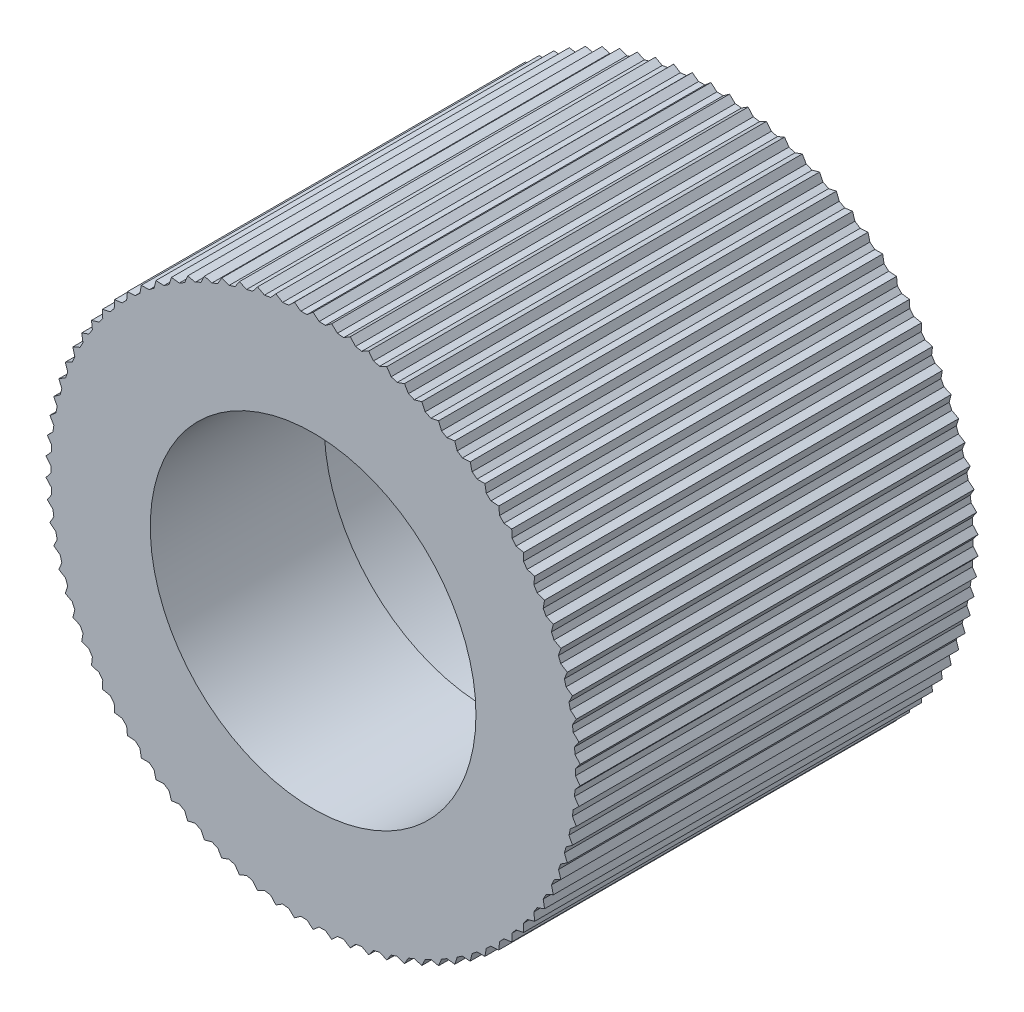
from build123d import *

# Parameters (mm, degrees)
CROQUIS1_R              = 5.275
CROQUIS1_R_2            = 3.275
SALIENTE_EXTRUIR1_DEPTH = 1.75
CROQUIS2_R              = 5.275
CROQUIS2_R_2            = 3.975
SALIENTE_EXTRUIR2_DEPTH = 4.5
SALIENTE_EXTRUIR3_START = 1.75
SALIENTE_EXTRUIR3_DEPTH = 8
MATRIZC1_COUNT          = 90


with BuildPart() as part:
    # Croquis1 → Saliente-Extruir1 (new, symmetric)
    with BuildSketch(Plane.XY):
        Circle(CROQUIS1_R)
        Circle(CROQUIS1_R_2, mode=Mode.SUBTRACT)
    extrude(amount=SALIENTE_EXTRUIR1_DEPTH, both=True)

    # Croquis2 → Saliente-Extruir2 (add)
    with BuildSketch(Plane(origin=(0, 0, -1.75), x_dir=(-1, 0, 0), z_dir=(0, 0, -1))):
        Circle(CROQUIS2_R)
        Circle(CROQUIS2_R_2, mode=Mode.SUBTRACT)
    extrude(amount=SALIENTE_EXTRUIR2_DEPTH)

    # Croquis6 → Saliente-Extruir3 (add)
    with BuildSketch(Plane.XY.offset(SALIENTE_EXTRUIR3_START)):
        with BuildLine():
            Line((0, 5.375), (0, 5.275))
            ThreePointArc((0, 5.275), (0.060416297, 5.274654005), (0.120824669, 5.273616065))
            Line((0.120824669, 5.273616065), (0, 5.375))
        make_face()
        with BuildLine():
            ThreePointArc((-0.120824669, 5.273616065), (-0.060416297, 5.274654005), (0, 5.275))
            Line((0, 5.275), (0, 5.375))
            Line((0, 5.375), (-0.120824669, 5.273616065))
        make_face()
    saliente_extruir3 = extrude(amount=-SALIENTE_EXTRUIR3_DEPTH)

    # MatrizC1: Saliente-Extruir3 ×90 about axis
    matrizc1_axis = Axis((0, 0, 0), (0, 0, 1))
    for i in range(1, MATRIZC1_COUNT):
        add(saliente_extruir3.rotate(matrizc1_axis, i * 360 / MATRIZC1_COUNT))


solid = part.part
